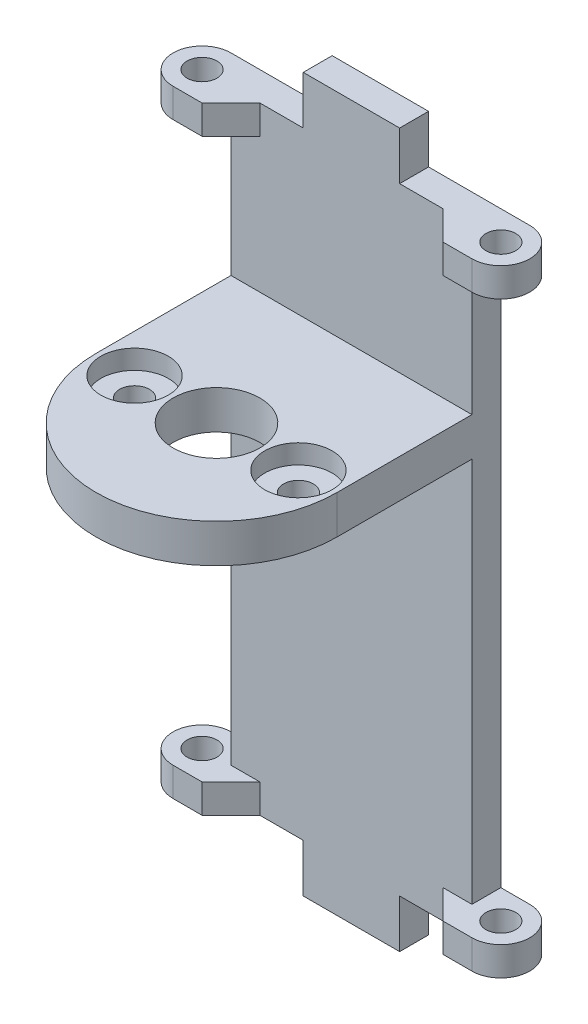
from build123d import *

# Parameters (mm, degrees)
SKETCH11_R          = 1.55
SKETCH11_R_2        = 4.5
BOSS_EXTRUDE1_DEPTH = 4
BOSS_EXTRUDE2_DEPTH = 3
SKETCH13_R          = 3.5
CUT_EXTRUDE1_DEPTH  = 2
SKETCH14_R          = 1.55
BOSS_EXTRUDE3_DEPTH = 3
BOSS_EXTRUDE4_START = -3
SKETCH15_R          = 1.55
BOSS_EXTRUDE4_DEPTH = 3


with BuildPart() as part:
    # Sketch11 → Boss-Extrude1 (new body)
    with BuildSketch(Plane(origin=(0, 0, 51.65), x_dir=(1, 0, 0), z_dir=(0, -1, 0))):
        with BuildLine():
            Line((12.5, 85.5), (12.5, 71.5))
            Line((12.5, 71.5), (-12.5, 71.5))
            Line((-12.5, 71.5), (-12.5, 85.5))
            ThreePointArc((-12.5, 85.5), (0, 98), (12.5, 85.5))
        make_face()
        with Locations((-8.5, 85.5)):
            Circle(SKETCH11_R, mode=Mode.SUBTRACT)
        with Locations((8.5, 85.5)):
            Circle(SKETCH11_R, mode=Mode.SUBTRACT)
        with Locations((0, 85.5)):
            Circle(SKETCH11_R_2, mode=Mode.SUBTRACT)
    extrude(amount=BOSS_EXTRUDE1_DEPTH)

    # Sketch12 → Boss-Extrude2 (add)
    with BuildSketch(Plane(origin=(0, 0, 123.15), x_dir=(-1, 0, 0), z_dir=(0, 0, -1))):
        Polygon((-12.5, 0), (-12.5, 17), (-5, 17), (-5, 22), (5, 22), (5, 17), (12.5, 17), (12.5, 0), (12.5, -4), (12.5, -47), (5, -47), (5, -52), (-5, -52), (-5, -47), (-12.5, -47), (-12.5, -4), align=None)
    extrude(amount=BOSS_EXTRUDE2_DEPTH)

    # Sketch13 → Cut-Extrude1 (cut)
    with BuildSketch(Plane(origin=(0, 0, 0), x_dir=(1, 0, 0), z_dir=(0, 1, 0))):
        with Locations((-8.5, -137.15)):
            Circle(SKETCH13_R)
        with Locations((8.5, -137.15)):
            Circle(SKETCH13_R)
    extrude(amount=-CUT_EXTRUDE1_DEPTH, mode=Mode.SUBTRACT)

    # Sketch14 → Boss-Extrude3 (add)
    with BuildSketch(Plane(origin=(0, 17, 0), x_dir=(1, 0, 0), z_dir=(0, 1, 0))):
        with BuildLine():
            Line((15.5, -120.15), (-15.5, -120.15))
            ThreePointArc((-15.5, -120.15), (-18.5, -123.15), (-15.5, -126.15))
            Line((-15.5, -126.15), (-12.5, -126.15))
            Line((-12.5, -126.15), (-9.5, -123.15))
            Line((-9.5, -123.15), (9.5, -123.15))
            Line((9.5, -123.15), (12.5, -126.15))
            Line((12.5, -126.15), (15.5, -126.15))
            ThreePointArc((15.5, -126.15), (18.5, -123.15), (15.5, -120.15))
        make_face()
        with Locations((-15.5, -123.15)):
            Circle(SKETCH14_R, mode=Mode.SUBTRACT)
        with Locations((15.5, -123.15)):
            Circle(SKETCH14_R, mode=Mode.SUBTRACT)
    extrude(amount=-BOSS_EXTRUDE3_DEPTH)

    # Sketch15 → Boss-Extrude4 (add)
    with BuildSketch(Plane(origin=(0, -47, 0), x_dir=(-1, 0, 0), z_dir=(0, -1, 0)).offset(BOSS_EXTRUDE4_START)):
        with BuildLine():
            Line((15.5, -120.15), (-15.5, -120.15))
            ThreePointArc((-15.5, -120.15), (-18.5, -123.15), (-15.5, -126.15))
            Line((-15.5, -126.15), (-12.5, -126.15))
            Line((-12.5, -126.15), (-9.5, -123.15))
            Line((-9.5, -123.15), (9.5, -123.15))
            Line((9.5, -123.15), (12.5, -126.15))
            Line((12.5, -126.15), (15.5, -126.15))
            ThreePointArc((15.5, -126.15), (18.5, -123.15), (15.5, -120.15))
        make_face()
        with Locations((15.5, -123.15)):
            Circle(SKETCH15_R, mode=Mode.SUBTRACT)
        with Locations((-15.5, -123.15)):
            Circle(SKETCH15_R, mode=Mode.SUBTRACT)
    extrude(amount=BOSS_EXTRUDE4_DEPTH)


solid = part.part
